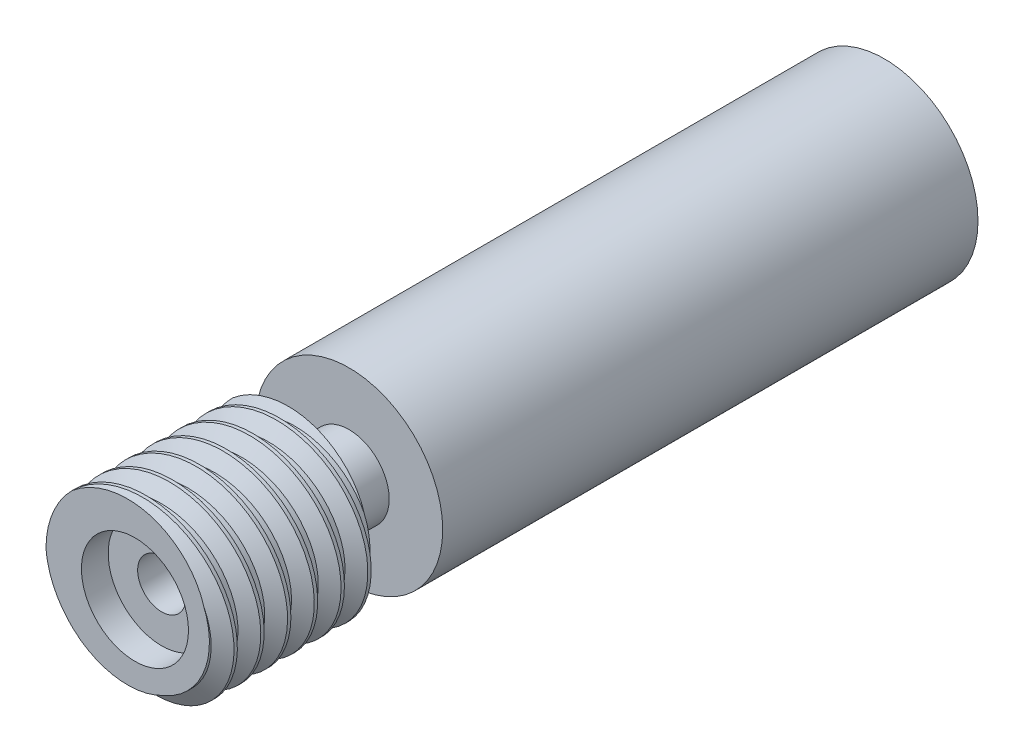
from build123d import *

# Parameters (mm, degrees)
SKETCH1_R           = 3.5
BOSS_EXTRUDE1_DEPTH = 28
SKETCH2_R           = 0.9
CUT_EXTRUDE1_DEPTH  = 40
SKETCH3_R           = 2
CUT_EXTRUDE2_DEPTH  = 1
SKETCH9_R           = 4
SKETCH9_R_2         = 3.323417656
CUT_EXTRUDE4_DEPTH  = 8
CUT_EXTRUDE6_START  = 2
SKETCH10_R          = 3.323417656
SKETCH10_R_2        = 1.5
CUT_EXTRUDE6_DEPTH  = 2
THREAD1_PITCH       = 1
THREAD1_TO          = 7
SKETCH15_R          = 2.5
CUT_EXTRUDE7_DEPTH  = 3


with BuildPart() as part:
    # Sketch1 → Boss-Extrude1 (new body)
    with BuildSketch(Plane.XY):
        Circle(SKETCH1_R)
    extrude(amount=BOSS_EXTRUDE1_DEPTH)

    # Sketch2 → Cut-Extrude1 (cut)
    with BuildSketch(Plane(origin=(0, 0, 0), x_dir=(-1, 0, 0), z_dir=(0, 0, -1))):
        Circle(SKETCH2_R)
    extrude(amount=-CUT_EXTRUDE1_DEPTH, mode=Mode.SUBTRACT)

    # Sketch3 → Cut-Extrude2 (cut)
    with BuildSketch(Plane.XY.offset(28)):
        Circle(SKETCH3_R)
    extrude(amount=-CUT_EXTRUDE2_DEPTH, mode=Mode.SUBTRACT)

    # Sketch9 → Cut-Extrude4 (cut)
    with BuildSketch(Plane.XY.offset(28)):
        Circle(SKETCH9_R)
        Circle(SKETCH9_R_2, mode=Mode.SUBTRACT)
    extrude(amount=-CUT_EXTRUDE4_DEPTH, mode=Mode.SUBTRACT)

    # Sketch10 → Cut-Extrude6 (cut)
    with BuildSketch(Plane.XY.offset(20).offset(CUT_EXTRUDE6_START)):
        Circle(SKETCH10_R)
        Circle(SKETCH10_R_2, mode=Mode.SUBTRACT)
    extrude(amount=-CUT_EXTRUDE6_DEPTH, mode=Mode.SUBTRACT)

    # Thread1: arcs per turn and ends read off the stored shape
    # Thread1: the profile of Thread Profile1 profile screwed along a right-hand helix through 15 turns, 8 arcs to a turn; built about Z, then put on its axis
    thread1_z = Axis((0, 0, 0), (0, 0, 1))
    thread1_corners = [(3.323717656, 0, -0.000173205), (3.323717656, 0, 0.875173202), (2.782151781, 0, 0.562499999), (2.782151781, 0, 0.312499999)]
    with BuildLine(mode=Mode.PRIVATE) as thread1_profile:
        Line(thread1_corners[0], thread1_corners[1])
        Line(thread1_corners[1], thread1_corners[2])
        Line(thread1_corners[2], thread1_corners[3])
        Line(thread1_corners[3], thread1_corners[0])
    thread1_cap = Face(thread1_profile.wire())
    thread1_turn_angles = [0, 22.5, 45, 67.5, 90, 112.5, 135, 157.5, 180, 202.5, 225, 247.5, 270, 292.5, 315, 337.5, 360]
    thread1_turn_weights = [1, 0.9238795325112867, 1, 0.9238795325112867, 1, 0.9238795325112867, 1, 0.9238795325112867, 1, 0.9238795325112867, 1, 0.9238795325112867, 1, 0.9238795325112867, 1, 0.9238795325112867, 1]
    thread1_turn_rails = [Edge.make_bspline([Vector(p[0], p[1], 0).rotate(thread1_z, thread1_turn_angles[k]) / thread1_turn_weights[k] + Vector(0, 0, p[2] + THREAD1_PITCH * thread1_turn_angles[k] / 360) for k in range(17)], [0, 0, 0, 1, 1, 2, 2, 3, 3, 4, 4, 5, 5, 6, 6, 7, 7, 8, 8, 8], 2, thread1_turn_weights) for p in thread1_corners]
    thread1_turn_sides = [Face.make_surface_from_curves(thread1_turn_rails[p[0]], thread1_turn_rails[p[1]]) for p in [(0, 1), (1, 2), (2, 3), (3, 0)]]
    thread1 = Plane(origin=(0, 0, 29), x_dir=(-1, 0, 0), z_dir=(0, 0, -1)) * split(Solid(Shell([*[p.moved(Location((0, 0, THREAD1_PITCH * i))) for i in range(15) for p in thread1_turn_sides], thread1_cap, thread1_cap.rotate(thread1_z, 5400).moved(Location((0, 0, THREAD1_PITCH * 5400 / 360)))])), bisect_by=Plane.XY.offset(THREAD1_TO), keep=Keep.BOTTOM, mode=Mode.PRIVATE)
    add(thread1, mode=Mode.SUBTRACT)

    # Sketch15 → Cut-Extrude7 (cut)
    with BuildSketch(Plane(origin=(0, 0, 0), x_dir=(-1, 0, 0), z_dir=(0, 0, -1))):
        Circle(SKETCH15_R)
    extrude(amount=-CUT_EXTRUDE7_DEPTH, mode=Mode.SUBTRACT)


solid = part.part
